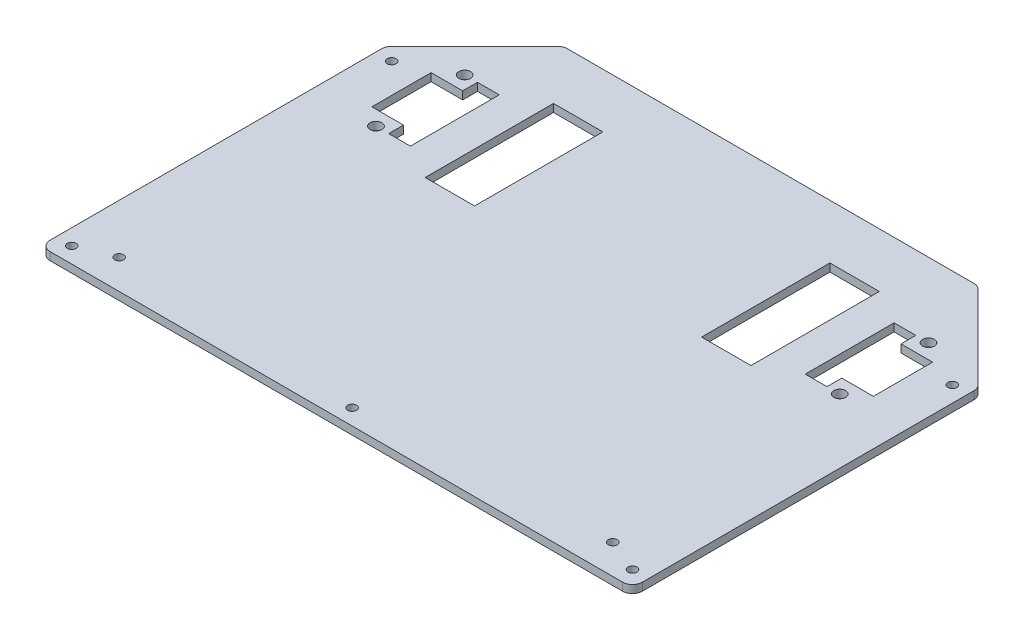
from build123d import *

# Parameters (mm, degrees)
MAIN_EXTRUSION_DEPTH    = 4
CORNER_LEAVE_R          = 5
ESQUISSE2_R             = 3
ESQUISSE2_W             = 25
ESQUISSE2_H             = 65
ENL_V_MAT_EXTRU_1_DEPTH = 267.30058205
D_GAGEMENT_M41_D        = 4.5
D_GAGEMENT_M42_D        = 4.5


with BuildPart() as part:
    # Main scetch → Main extrusion (new body)
    with BuildSketch(Plane(origin=(0, 0, 0), x_dir=(1, 0, 0), z_dir=(0, 1, 0))):
        Polygon((-150, 0), (150, 0), (150, 175), (105, 220), (-105, 220), (-150, 175), align=None)
    extrude(amount=MAIN_EXTRUSION_DEPTH)

    # Corner leave
    corner_leave_edges = [part.edges().sort_by_distance(p)[0] for p in [
        (-150, 2, 0),
        (150, 2, -175),
        (105, 2, -220),
        (150, 2, 0),
        (-105, 2, -220),
        (-150, 2, -175),
    ]]
    fillet(corner_leave_edges, radius=CORNER_LEAVE_R)

    # Esquisse2 → Enlèv. mat.-Extru.1 (cut, through all)
    with BuildSketch(Plane(origin=(0, 4, 0), x_dir=(1, 0, 0), z_dir=(0, 1, 0))):
        with Locations((117.47, 182.47)):
            Circle(ESQUISSE2_R)
        with Locations((117.47, 137.53)):
            Circle(ESQUISSE2_R)
        with Locations((-117.47, 137.53)):
            Circle(ESQUISSE2_R)
        with Locations((-117.47, 182.47)):
            Circle(ESQUISSE2_R)
        with Locations((70, 160)):
            Rectangle(ESQUISSE2_W, ESQUISSE2_H)
        Polygon((100, 137.5), (100, 182.5), (111, 182.5), (111, 175), (127, 175), (127, 145), (111, 145), (111, 137.5), align=None)
        Polygon((-111, 137.5), (-111, 145), (-127, 145), (-127, 175), (-111, 175), (-111, 182.5), (-100, 182.5), (-100, 137.5), align=None)
        with Locations((-70, 160)):
            Rectangle(ESQUISSE2_W, ESQUISSE2_H)
    extrude(amount=-ENL_V_MAT_EXTRU_1_DEPTH, mode=Mode.SUBTRACT)

    # Dégagement M41 (through all)
    with Locations(Plane(origin=(0, 4, 0), x_dir=(1, 0, 0), z_dir=(0, 1, 0))):
        with Locations((-125, 15), (125, 15)):
            Hole(D_GAGEMENT_M41_D / 2)

    # Dégagement M42 (through all)
    with Locations(Plane(origin=(0, 4, 0), x_dir=(1, 0, 0), z_dir=(0, 1, 0))):
        with Locations((-142, 8), (0, 8), (142, 8), (142, 170), (-142, 170)):
            Hole(D_GAGEMENT_M42_D / 2)


solid = part.part
